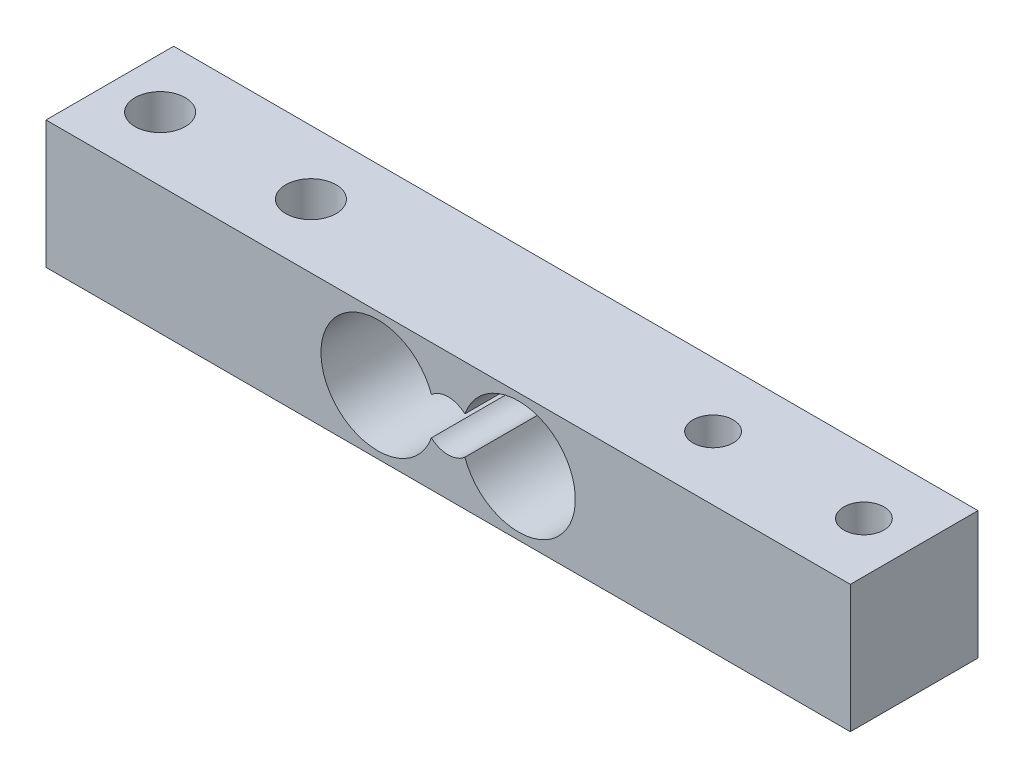
from build123d import *

# Parameters (mm, degrees)
SKETCH1_W           = 80
SKETCH1_H           = 12.7
SKETCH1_R           = 2.5
SKETCH1_R_2         = 2
BOSS_EXTRUDE1_DEPTH = 12.7
CUT_EXTRUDE1_DEPTH  = 44.847234804


with BuildPart() as part:
    # Sketch1 → Boss-Extrude1 (new body)
    with BuildSketch(Plane(origin=(0, 0, 0), x_dir=(1, 0, 0), z_dir=(0, 1, 0))):
        Rectangle(SKETCH1_W, SKETCH1_H)
        with Locations((-35, 0)):
            Circle(SKETCH1_R, mode=Mode.SUBTRACT)
        with Locations((-20, 0)):
            Circle(SKETCH1_R, mode=Mode.SUBTRACT)
        with Locations((20, 0)):
            Circle(SKETCH1_R_2, mode=Mode.SUBTRACT)
        with Locations((35, 0)):
            Circle(SKETCH1_R_2, mode=Mode.SUBTRACT)
    extrude(amount=BOSS_EXTRUDE1_DEPTH)

    # Sketch2 → Cut-Extrude1 (cut, through all)
    with BuildSketch(Plane.XY.offset(6.35)):
        with BuildLine():
            ThreePointArc((-1.66625, 8.213762575), (-12.65, 6.35), (-1.66625, 4.486237425))
            ThreePointArc((-1.66625, 4.486237425), (0, 3.85), (1.66625, 4.486237425))
            ThreePointArc((1.66625, 4.486237425), (12.65, 6.35), (1.66625, 8.213762575))
            ThreePointArc((1.66625, 8.213762575), (0, 8.85), (-1.66625, 8.213762575))
        make_face()
    extrude(amount=-CUT_EXTRUDE1_DEPTH, mode=Mode.SUBTRACT)


solid = part.part
